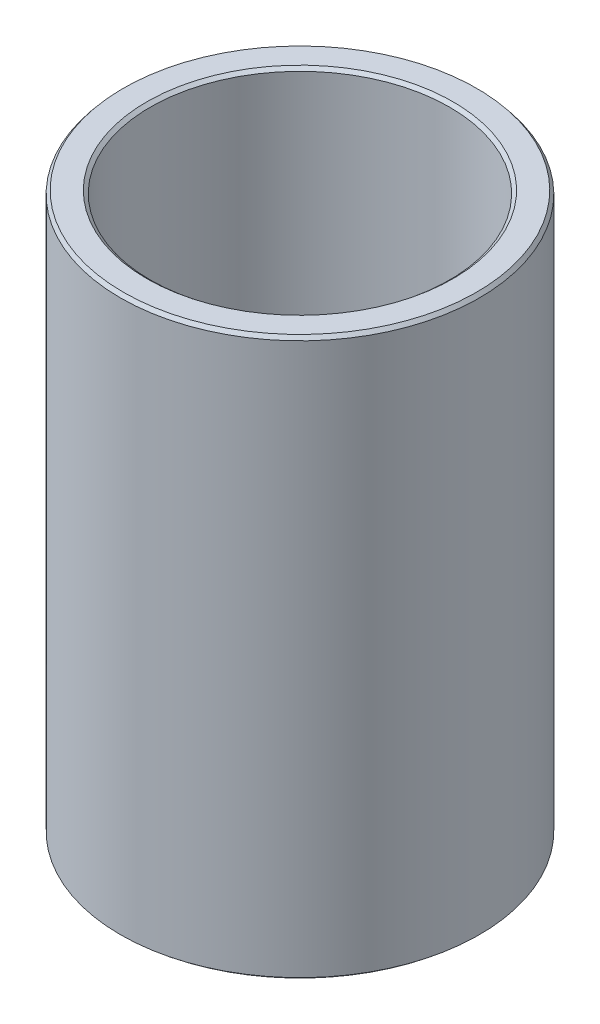
from build123d import *
from OCP.BRepFilletAPI import BRepFilletAPI_MakeChamfer

# Parameters (mm, degrees)
SKETCH1_R           = 40
BOSS_EXTRUDE1_DEPTH = 124.308796418
SKETCH2_R           = 33.35546073
CUT_EXTRUDE1_DEPTH  = 137.574803192
CHAMFER1_SIZE       = 0.780202415
CHAMFER1_SIZE2      = 0.638092898


with BuildPart() as part:
    # Sketch1 → Boss-Extrude1 (new body)
    with BuildSketch(Plane(origin=(0, 0, 0), x_dir=(1, 0, 0), z_dir=(0, 1, 0))):
        Circle(SKETCH1_R)
    extrude(amount=BOSS_EXTRUDE1_DEPTH)

    # Sketch2 → Cut-Extrude1 (cut, through all)
    with BuildSketch(Plane(origin=(0, 0, 0), x_dir=(1, 0, 0), z_dir=(0, 1, 0))):
        Circle(SKETCH2_R)
    extrude(amount=CUT_EXTRUDE1_DEPTH, mode=Mode.SUBTRACT)

    # Chamfer1: one chamfer whose edges measure the first distance from different faces: ONE call of the kernel's chamfer builder (chamfer() names one face for all edges)
    chamfer1_edges_1 = [part.edges().sort_by_distance(p)[0] for p in [
        (-33.35546073, 124.308796418, 0),
    ]]
    chamfer1_side_1 = [part.faces().sort_by_distance(p)[0] for p in [
        (-38.86862915, 124.308796418, 0),
    ]]
    chamfer1_edges_2 = [part.edges().sort_by_distance(p)[0] for p in [
        (-33.35546073, 0, 0),
    ]]
    chamfer1_side_2 = [part.faces().sort_by_distance(p)[0] for p in [
        (-33.35546073, 62.154398209, 0),
    ]]
    chamfer1_edges_3 = [part.edges().sort_by_distance(p)[0] for p in [
        (-40, 0, 0),
    ]]
    chamfer1_side_3 = [part.faces().sort_by_distance(p)[0] for p in [
        (-38.86862915, 0, 0),
    ]]
    chamfer1_edges_4 = [part.edges().sort_by_distance(p)[0] for p in [
        (-40, 124.308796418, 0),
    ]]
    chamfer1_side_4 = [part.faces().sort_by_distance(p)[0] for p in [
        (-40, 62.154398209, 0),
    ]]
    chamfer1 = BRepFilletAPI_MakeChamfer(part.part.solid().wrapped)
    for e in chamfer1_edges_1:
        chamfer1.Add(CHAMFER1_SIZE, CHAMFER1_SIZE2, e.wrapped, chamfer1_side_1[0].wrapped)  # the first distance lies on this face
    for e in chamfer1_edges_2:
        chamfer1.Add(CHAMFER1_SIZE, CHAMFER1_SIZE2, e.wrapped, chamfer1_side_2[0].wrapped)  # the first distance lies on this face
    for e in chamfer1_edges_3:
        chamfer1.Add(CHAMFER1_SIZE, CHAMFER1_SIZE2, e.wrapped, chamfer1_side_3[0].wrapped)  # the first distance lies on this face
    for e in chamfer1_edges_4:
        chamfer1.Add(CHAMFER1_SIZE, CHAMFER1_SIZE2, e.wrapped, chamfer1_side_4[0].wrapped)  # the first distance lies on this face
    add(Compound.cast(chamfer1.Shape()), mode=Mode.REPLACE)


solid = part.part
